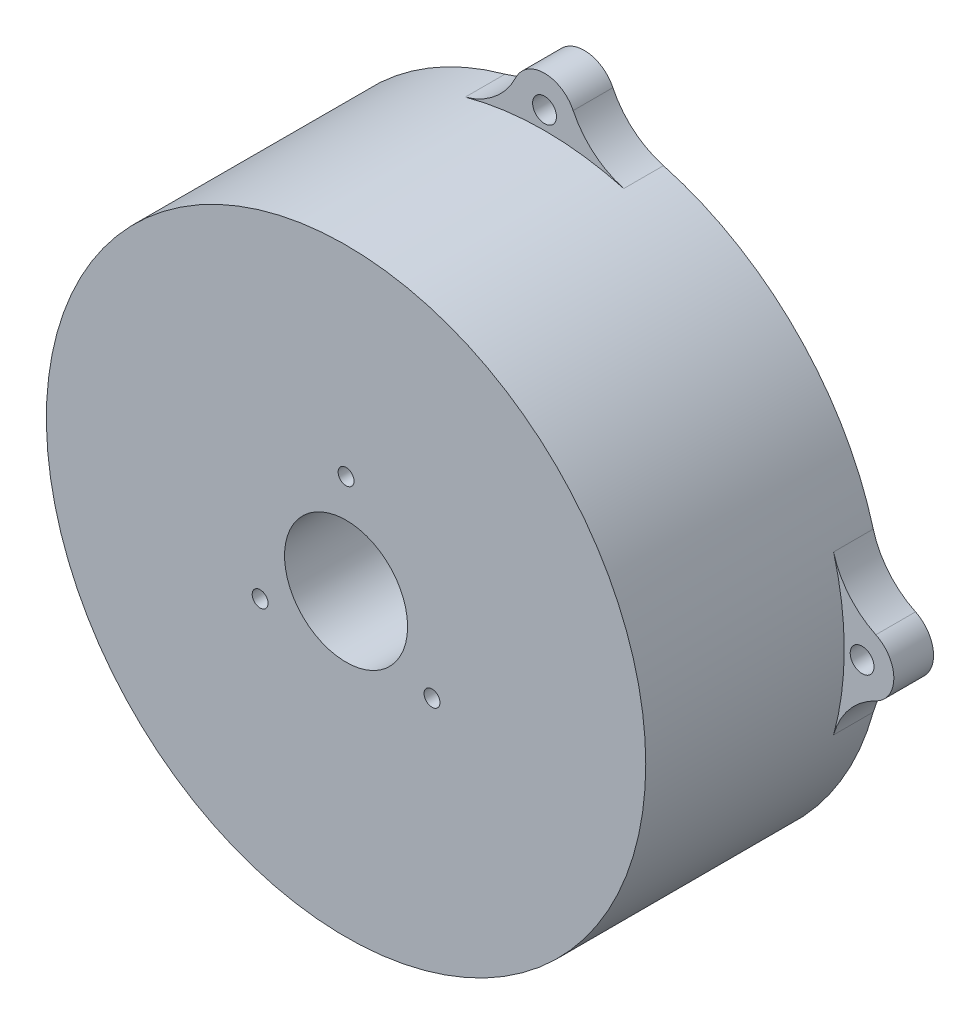
from build123d import *

# Parameters (mm, degrees)
SKETCH2_R                = 37.75
SKETCH2_R_2              = 7.75
BOSS_EXTRUDE1_DEPTH      = 30
SKETCH3_R                = 1
CUT_EXTRUDE1_DEPTH       = 10
SKETCH4_R                = 1.5
BOSS_EXTRUDE2_DEPTH      = 5
FILLET1_R                = 10
CIRPATTERN1_COUNT        = 4
FILLET1_OF_CIRPATTERN1_R = 10


with BuildPart() as part:
    # Sketch2 → Boss-Extrude1 (new body)
    with BuildSketch(Plane.XY):
        Circle(SKETCH2_R)
        Circle(SKETCH2_R_2, mode=Mode.SUBTRACT)
    extrude(amount=BOSS_EXTRUDE1_DEPTH)

    # Sketch3 → Cut-Extrude1 (cut)
    with BuildSketch(Plane.XY.offset(30)):
        with Locations((0, 12.5)):
            Circle(SKETCH3_R)
        with Locations((10.825317547, -6.25)):
            Circle(SKETCH3_R)
        with Locations((-10.825317547, -6.25)):
            Circle(SKETCH3_R)
    extrude(amount=-CUT_EXTRUDE1_DEPTH, mode=Mode.SUBTRACT)

    # Sketch4 → Boss-Extrude2 (add)
    with BuildSketch(Plane(origin=(0, 0, 0), x_dir=(-1, 0, 0), z_dir=(0, 0, -1))):
        with BuildLine():
            Line((-4, 37.495028442), (0, 37.75))
            Line((0, 37.75), (4, 37.495028442))
            Line((4, 37.495028442), (4, 40))
            ThreePointArc((4, 40), (0, 44), (-4, 40))
            Line((-4, 40), (-4, 37.495028442))
        make_face()
        with Locations((0, 40)):
            Circle(SKETCH4_R, mode=Mode.SUBTRACT)
    boss_extrude2 = extrude(amount=-BOSS_EXTRUDE2_DEPTH)

    # Fillet1
    # the kernel refuses this fillet: 10 mm, written as the material it adds along each edge
    with BuildSketch(Plane(origin=(4, 37.537481269, 5), x_dir=(0.9825908408243521, -0.18578277511139904, 0), z_dir=(0, 0, -1))) as fillet1_piece_1:
        with BuildLine():
            CenterArc((6.893121156, -9.967448048), FILLET1_R, 94.624278966, 49.061773925)
            Line((-1.164720332, -4.045354621), (-1.970504481, -3.453145278))
            ThreePointArc((-1.970504481, -3.453145278), (-1.440084404, -2.233865576), (-0.982590841, 0.185782775))
            Line((-0.982590841, 0.185782775), (0.0806213, 0.996744805))
            ThreePointArc((0.0806213, 0.996744805), (3.043454077, 0.877116383), (6.006286855, 0.996744805))
            Line((6.006286855, 0.996744805), (6.086908155, 0))
        make_face()
    extrude(amount=5)
    with BuildSketch(Plane(origin=(-4, 37.537481269, 5), x_dir=(-0.9825908408243521, -0.185782775111399, 0), z_dir=(0, 0, -1))) as fillet1_piece_2:
        with BuildLine():
            CenterArc((6.893121156, 9.967448048), FILLET1_R, 216.31394711, 49.061773925)
            Line((-1.164720332, 4.045354621), (-1.970504481, 3.453145278))
            ThreePointArc((-1.970504481, 3.453145278), (-1.440084404, 2.233865576), (-0.982590841, -0.185782775))
            Line((-0.982590841, -0.185782775), (0.0806213, -0.996744805))
            ThreePointArc((0.0806213, -0.996744805), (3.043454077, -0.877116383), (6.006286855, -0.996744805))
            Line((6.006286855, -0.996744805), (6.086908155, 0))
        make_face()
    extrude(amount=5)

    # CirPattern1: Boss-Extrude2 ×4 about axis
    cirpattern1_axis = Axis((0, 0, 0), (0, 0, 1))
    for i in range(1, CIRPATTERN1_COUNT):
        add(boss_extrude2.rotate(cirpattern1_axis, i * 360 / CIRPATTERN1_COUNT))

    # Fillet1 of CirPattern1
    # the kernel refuses this fillet: 10 mm, written as the material it adds along each edge
    with BuildSketch(Plane(origin=(-37.537481269, 4, 5), x_dir=(0.18578277511140276, 0.9825908408243514, 0), z_dir=(0, 0, -1)), Plane(origin=(-4, -37.537481269, 5), x_dir=(-0.9825908408243512, 0.18578277511140392, 0), z_dir=(0, 0, -1)), Plane(origin=(37.537481269, -4, 5), x_dir=(-0.1857827751114012, -0.9825908408243518, 0), z_dir=(0, 0, -1))) as fillet1_of_cirpattern1_piece_1:
        with BuildLine():
            CenterArc((6.893121156, -9.967448048), FILLET1_OF_CIRPATTERN1_R, 94.624278966, 49.061773925)
            Line((-1.164720332, -4.045354621), (-1.970504481, -3.453145278))
            ThreePointArc((-1.970504481, -3.453145278), (-1.440084404, -2.233865576), (-0.982590841, 0.185782775))
            Line((-0.982590841, 0.185782775), (0.0806213, 0.996744805))
            ThreePointArc((0.0806213, 0.996744805), (3.043454077, 0.877116383), (6.006286855, 0.996744805))
            Line((6.006286855, 0.996744805), (6.086908155, 0))
        make_face()
    extrude(amount=5)
    with BuildSketch(Plane(origin=(-37.537481269, -4, 5), x_dir=(0.1857827751113977, -0.9825908408243523, 0), z_dir=(0, 0, -1)), Plane(origin=(4, -37.537481269, 5), x_dir=(0.9825908408243529, 0.18578277511139504, 0), z_dir=(0, 0, -1)), Plane(origin=(37.537481269, 4, 5), x_dir=(-0.18578277511139632, 0.9825908408243527, 0), z_dir=(0, 0, -1))) as fillet1_of_cirpattern1_piece_2:
        with BuildLine():
            CenterArc((6.893121156, 9.967448048), FILLET1_OF_CIRPATTERN1_R, 216.31394711, 49.061773925)
            Line((-1.164720332, 4.045354621), (-1.970504481, 3.453145278))
            ThreePointArc((-1.970504481, 3.453145278), (-1.440084404, 2.233865576), (-0.982590841, -0.185782775))
            Line((-0.982590841, -0.185782775), (0.0806213, -0.996744805))
            ThreePointArc((0.0806213, -0.996744805), (3.043454077, -0.877116383), (6.006286855, -0.996744805))
            Line((6.006286855, -0.996744805), (6.086908155, 0))
        make_face()
    extrude(amount=5)


solid = part.part
